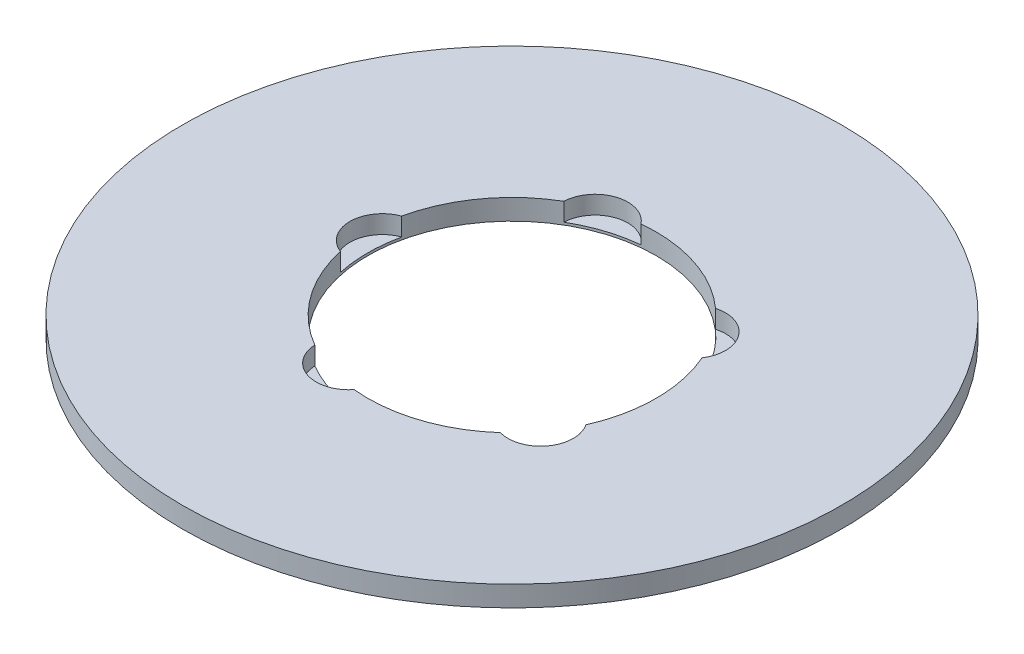
from build123d import *

# Parameters (mm, degrees)
SKETCH1_R           = 80
BOSS_EXTRUDE1_DEPTH = 5
SKETCH2_R           = 35
CUT_EXTRUDE1_DEPTH  = 114.247516529
SKETCH3_R           = 7.927074955
CUT_EXTRUDE2_DEPTH  = 4.391545191
CIRPATTERN1_COUNT   = 5


with BuildPart() as part:
    # Sketch1 → Boss-Extrude1 (new body)
    with BuildSketch(Plane(origin=(0, 0, 0), x_dir=(1, 0, 0), z_dir=(0, 1, 0))):
        Circle(SKETCH1_R)
    extrude(amount=BOSS_EXTRUDE1_DEPTH)

    # Sketch2 → Cut-Extrude1 (cut, through all)
    with BuildSketch(Plane(origin=(0, 0, 0), x_dir=(1, 0, 0), z_dir=(0, 1, 0))):
        Circle(SKETCH2_R)
    extrude(amount=CUT_EXTRUDE1_DEPTH, mode=Mode.SUBTRACT)

    # Sketch3 → Cut-Extrude2 (cut)
    with BuildSketch(Plane(origin=(0, 5, 0), x_dir=(1, 0, 0), z_dir=(0, 1, 0))):
        with Locations((-31.443129334, 0)):
            Circle(SKETCH3_R)
    cut_extrude2 = extrude(amount=-CUT_EXTRUDE2_DEPTH, mode=Mode.SUBTRACT)

    # CirPattern1: Cut-Extrude2 ×5 about axis
    cirpattern1_axis = Axis((0, 0, 0), (0, 1, 0))
    for i in range(1, CIRPATTERN1_COUNT):
        add(cut_extrude2.rotate(cirpattern1_axis, i * 360 / CIRPATTERN1_COUNT), mode=Mode.SUBTRACT)


solid = part.part
